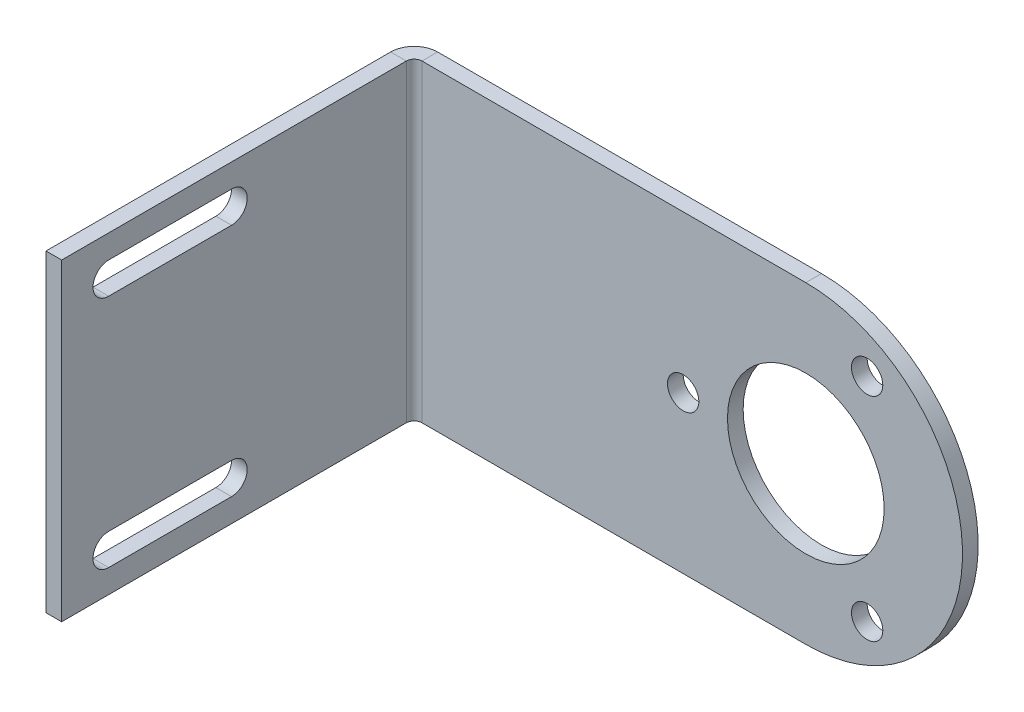
from build123d import *

# Parameters (mm, degrees)
SM_BASE_FLANGE_1_DEPTH           = 2
SKETCH_7_R                       = 10
SKETCH_7_R_2                     = 2
CUT_EXTRUDE_1_DEPTH              = 50.460967207
SM_EDGE_FLANGE_1_STRIP_W         = 10
SM_EDGE_FLANGE_1_STRIP_H         = 2
SM_EDGE_FLANGE_1_STRIP_CUT_DEPTH = 40
SM_EDGE_FLANGE_1_DEPTH           = 40
CUT_EXTRUDE_2_DEPTH              = 89.761563758


# Sheet-metal steps are written as plain solids
with BuildPart() as part:
    # Sketch 1 → 基体-法兰1 (new body)
    with BuildSketch(Plane.XY):
        with BuildLine():
            Line((-31.41539068, 9.119339374), (18.58460932, 9.119339374))
            ThreePointArc((18.58460932, 9.119339374), (38.58460932, -10.880660626), (18.58460932, -30.880660626))
            Line((18.58460932, -30.880660626), (-31.41539068, -30.880660626))
            Line((-31.41539068, -30.880660626), (-31.41539068, 9.119339374))
        make_face()
    extrude(amount=-SM_BASE_FLANGE_1_DEPTH)

    # 草图7 → 切除-拉伸1 (cut, through all)
    with BuildSketch(Plane.XY):
        with Locations((18.58460932, -10.880660626)):
            Circle(SKETCH_7_R)
        with Locations((2.928014356, -10.880660626)):
            Circle(SKETCH_7_R_2)
        with Locations((26.412906802, 2.67834835)):
            Circle(SKETCH_7_R_2)
        with Locations((26.412906802, -24.439669602)):
            Circle(SKETCH_7_R_2)
    extrude(amount=-CUT_EXTRUDE_1_DEPTH, mode=Mode.SUBTRACT)

    # 边线-法兰1 strip (across the edge) → 边线-法兰1 strip cut (cut)
    with BuildSketch(Plane(origin=(-31.41539068, 9.119339374, 0), x_dir=(1, 0, 0), z_dir=(0, -1, 0))):
        with Locations((-4, -1)):
            Rectangle(SM_EDGE_FLANGE_1_STRIP_W, SM_EDGE_FLANGE_1_STRIP_H)
    extrude(amount=SM_EDGE_FLANGE_1_STRIP_CUT_DEPTH, mode=Mode.SUBTRACT)

    # 边线-法兰1 section (across the edge) → 边线-法兰1 (add)
    with BuildSketch(Plane(origin=(-31.41539068, 9.119339374, 0), x_dir=(1, 0, 0), z_dir=(0, -1, 0))):
        with BuildLine():
            Line((-2, 1), (-2, 45))
            Line((-2, 45), (0, 45))
            Line((0, 45), (0, 1))
            ThreePointArc((0, 1), (0.292893219, 0.292893219), (1, 0))
            Line((1, 0), (1, -2))
            ThreePointArc((1, -2), (-1.121320344, -1.121320344), (-2, 1))
        make_face()
    extrude(amount=SM_EDGE_FLANGE_1_DEPTH)

    # 草图11 → 切除-拉伸2 (cut, through all)
    with BuildSketch(Plane(origin=(-31.41539068, 0, 0), x_dir=(0, 0, -1), z_dir=(1, 0, 0))):
        with BuildLine():
            Line((-39, 6.119339374), (-23.313924612, 6.119339374))
            ThreePointArc((-23.313924612, 6.119339374), (-21.313924612, 4.119339374), (-23.313924612, 2.119339374))
            Line((-23.313924612, 2.119339374), (-39, 2.119339374))
            ThreePointArc((-39, 2.119339374), (-41, 4.119339374), (-39, 6.119339374))
        make_face()
        with BuildLine():
            Line((-39, -27.880660626), (-23.313924612, -27.880660626))
            ThreePointArc((-23.313924612, -27.880660626), (-21.313924612, -25.880660626), (-23.313924612, -23.880660626))
            Line((-23.313924612, -23.880660626), (-39, -23.880660626))
            ThreePointArc((-39, -23.880660626), (-41, -25.880660626), (-39, -27.880660626))
        make_face()
    extrude(amount=-CUT_EXTRUDE_2_DEPTH, mode=Mode.SUBTRACT)


solid = part.part
